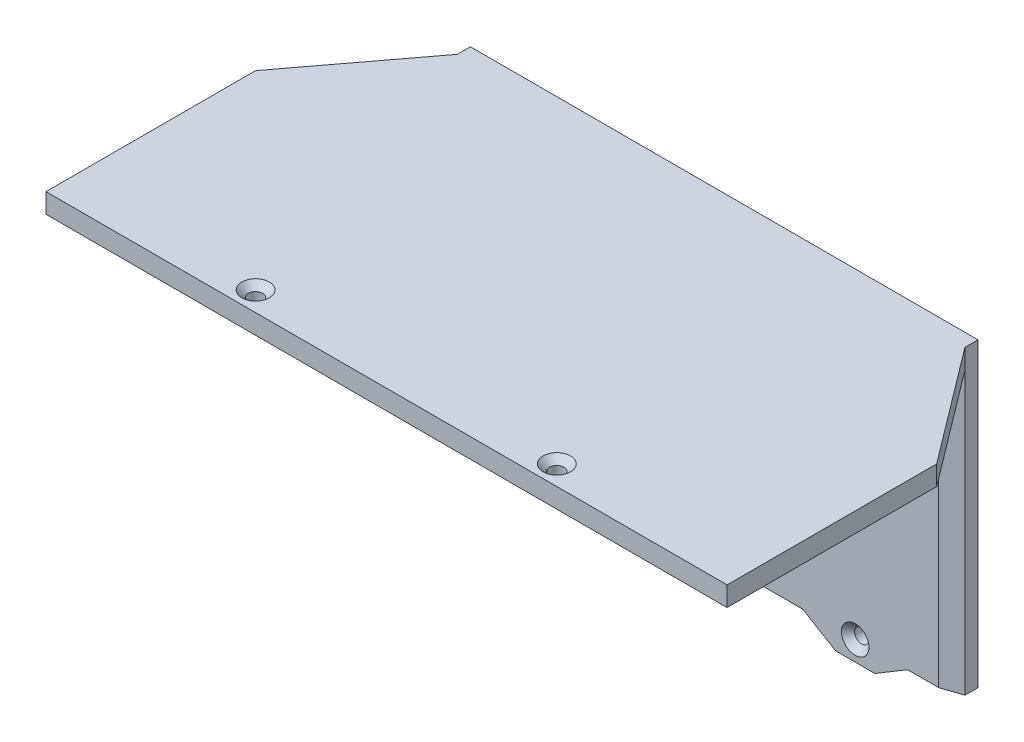
from build123d import *

# Parameters (mm, degrees)
DODANIE_WYCI_GNI_CIE1_DEPTH = 3
DODANIE_WYCI_GNI_CIE2_DEPTH = 43
DODANIE_WYCI_GNI_CIE3_DEPTH = 3
WYTNIJ_WYCI_GNI_CIE2_DEPTH  = 3
SZKIC3_R                    = 1.1
WYTNIJ_WYCI_GNI_CIE3_DEPTH  = 3
SFAZOWANIE1_SIZE            = 1
SFAZOWANIE2_SIZE            = 1


with BuildPart() as part:
    # Szkic1 → Dodanie-wyciągnięcie1 (new body)
    with BuildSketch(Plane(origin=(0, 0, 0), x_dir=(1, 0, 0), z_dir=(0, 1, 0))):
        Polygon((-35.75, -27.18761121), (-38.75, -26.182869049), (-52, -43.745257839), (-52, -75.745257839), (52, -75.745257839), (52, -43.745257839), (38.75, -26.182869049), (35.75, -27.18761121), align=None)
        Polygon((38.75, -24.18761121), (-38.75, -24.18761121), (-38.75, -26.182869049), (-35.75, -27.18761121), (35.75, -27.18761121), (38.75, -26.182869049), align=None)
    extrude(amount=DODANIE_WYCI_GNI_CIE1_DEPTH)

    # Szkic1<3> → Dodanie-wyciągnięcie2 (add)
    with BuildSketch(Plane(origin=(0, 0, 0), x_dir=(1, 0, 0), z_dir=(0, 1, 0))):
        Polygon((38.75, -24.18761121), (-38.75, -24.18761121), (-38.75, -26.182869049), (-35.75, -27.18761121), (35.75, -27.18761121), (38.75, -26.182869049), align=None)
    extrude(amount=-DODANIE_WYCI_GNI_CIE2_DEPTH)

    # Szkic2 → Dodanie-wyciągnięcie3 (add)
    with BuildSketch(Plane.XY.offset(27.18761121)):
        with BuildLine():
            Line((-26, -46), (-20, -46))
            Line((-20, -46), (-20, -43))
            Line((-20, -43), (-21.9, -43))
            ThreePointArc((-21.9, -43), (-23, -44.1), (-24.1, -43))
            Line((-24.1, -43), (-26, -43))
            Line((-26, -43), (-26, -46))
        make_face()
        with BuildLine():
            ThreePointArc((-24.1, -43), (-23, -44.1), (-21.9, -43))
            Line((-21.9, -43), (-24.1, -43))
        make_face()
        with BuildLine():
            Line((-24.1, -43), (-21.9, -43))
            ThreePointArc((-21.9, -43), (-23, -41.9), (-24.1, -43))
        make_face()
        with BuildLine():
            Line((20, -46), (26, -46))
            Line((26, -46), (26, -43))
            Line((26, -43), (24.1, -43))
            ThreePointArc((24.1, -43), (23, -44.1), (21.9, -43))
            Line((21.9, -43), (20, -43))
            Line((20, -43), (20, -46))
        make_face()
        with BuildLine():
            ThreePointArc((21.9, -43), (23, -44.1), (24.1, -43))
            Line((24.1, -43), (21.9, -43))
        make_face()
        with BuildLine():
            Line((21.9, -43), (24.1, -43))
            ThreePointArc((24.1, -43), (23, -41.9), (21.9, -43))
        make_face()
        Polygon((-30.998889877, -43), (-26, -46), (-26, -43), align=None)
        Polygon((-20, -46), (-15.001110123, -43), (-20, -43), align=None)
        Polygon((15.001110123, -43), (20, -46), (20, -43), align=None)
        Polygon((26, -43), (26, -46), (30.998889877, -43), align=None)
    extrude(amount=-DODANIE_WYCI_GNI_CIE3_DEPTH)

    # Szkic2<4> → Wytnij-wyciągnięcie2 (cut)
    with BuildSketch(Plane.XY.offset(27.18761121)):
        with BuildLine():
            ThreePointArc((-24.1, -43), (-23, -44.1), (-21.9, -43))
            Line((-21.9, -43), (-24.1, -43))
        make_face()
        with BuildLine():
            Line((-24.1, -43), (-21.9, -43))
            ThreePointArc((-21.9, -43), (-23, -41.9), (-24.1, -43))
        make_face()
        with BuildLine():
            ThreePointArc((21.9, -43), (23, -44.1), (24.1, -43))
            Line((24.1, -43), (21.9, -43))
        make_face()
        with BuildLine():
            Line((21.9, -43), (24.1, -43))
            ThreePointArc((24.1, -43), (23, -41.9), (21.9, -43))
        make_face()
    extrude(amount=-WYTNIJ_WYCI_GNI_CIE2_DEPTH, mode=Mode.SUBTRACT)

    # Szkic3 → Wytnij-wyciągnięcie3 (cut)
    with BuildSketch(Plane(origin=(0, 3, 0), x_dir=(1, 0, 0), z_dir=(0, 1, 0))):
        with Locations(Location((-23, -72.745257839, 0), (0, 0, 270))):
            Circle(SZKIC3_R)
        with Locations(Location((23, -72.745257839, 0), (0, 0, 270))):
            Circle(SZKIC3_R)
    extrude(amount=-WYTNIJ_WYCI_GNI_CIE3_DEPTH, mode=Mode.SUBTRACT)

    # Sfazowanie1
    sfazowanie1_edges = [part.edges().sort_by_distance(p)[0] for p in [
        (-23, 3, 71.645257839),
    ]]
    chamfer(sfazowanie1_edges, length=SFAZOWANIE1_SIZE)

    # Sfazowanie2
    sfazowanie2_edges = [part.edges().sort_by_distance(p)[0] for p in [
        (23, 3, 71.645257839),
    ]]
    chamfer(sfazowanie2_edges, length=SFAZOWANIE2_SIZE)

    # Sfazowanie3: read off the stored shape, not the designer's step
    # Sfazowanie3 outline → Sfazowanie3 (revolve, cut)
    with BuildSketch(Plane(origin=(23, -43, 0), x_dir=(1, 0, 0), z_dir=(0, -1, 0))):
        Polygon((1.1, 27.18761121), (1.1, 26.18761121), (2.1, 27.18761121), align=None)
    revolve(axis=Axis((23, -43, 0), (0, 0, 1)), mode=Mode.SUBTRACT)

    # Sfazowanie4: read off the stored shape, not the designer's step
    # Sfazowanie4 outline → Sfazowanie4 (revolve, cut)
    with BuildSketch(Plane(origin=(-23, -43, 0), x_dir=(1, 0, 0), z_dir=(0, -1, 0))):
        Polygon((1.1, 27.18761121), (1.1, 26.18761121), (2.1, 27.18761121), align=None)
    revolve(axis=Axis((-23, -43, 0), (0, 0, 1)), mode=Mode.SUBTRACT)


solid = part.part
